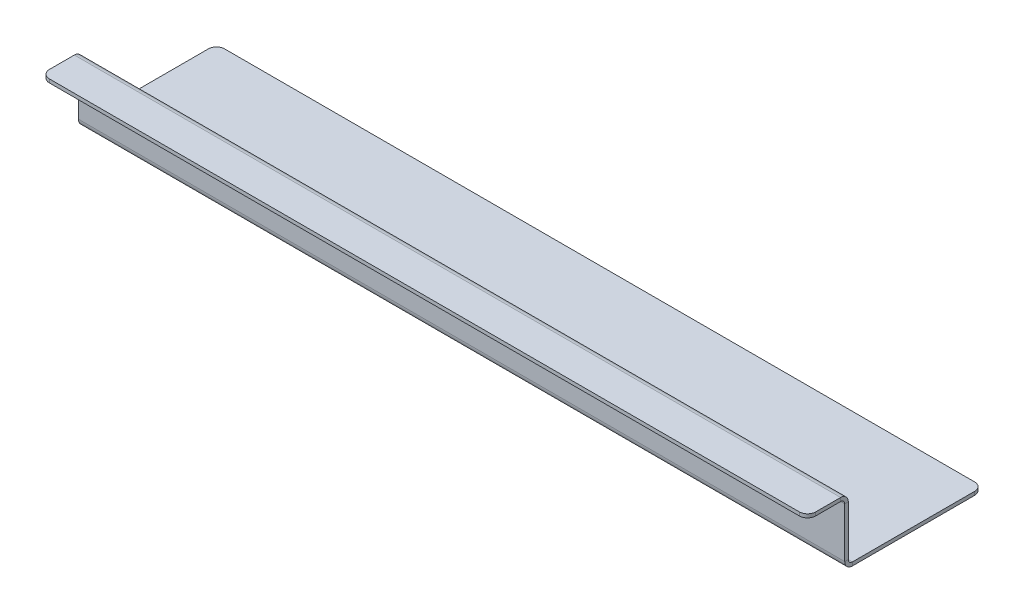
from build123d import *

# Parameters (mm, degrees)
SKETCH1_W                    = 596.9
SKETCH1_H                    = 31.75
BASE_FLANGE1_DEPTH           = 2.75336
EDGE_FLANGE1_STRIP_W         = 17.36344
EDGE_FLANGE1_STRIP_H         = 2.75336
EDGE_FLANGE1_STRIP_CUT_DEPTH = 596.9
EDGE_FLANGE1_DEPTH           = 596.9
EDGE_FLANGE2_STRIP_W         = 17.36344
EDGE_FLANGE2_STRIP_H         = 2.75336
EDGE_FLANGE2_STRIP_CUT_DEPTH = 596.9
EDGE_FLANGE2_DEPTH           = 596.9
BREAK_CORNER1_START          = -50.8
BREAK_CORNER1_DEPTH          = 50.8


# Read off the part's stored shape, not the designer's step: Break-Corner1
# Sheet-metal steps are written as plain solids
with BuildPart() as part:
    # Sketch1 → Base-Flange1 (new body)
    with BuildSketch(Plane(origin=(0, 0, 0), x_dir=(1, 0, 0), z_dir=(0, 1, 0))):
        with Locations((298.45, 15.875)):
            Rectangle(SKETCH1_W, SKETCH1_H)
    extrude(amount=-BASE_FLANGE1_DEPTH)

    # Edge-Flange1 strip (across the edge) → Edge-Flange1 strip cut (cut)
    with BuildSketch(Plane(origin=(0, -2.75336, -31.75), x_dir=(0, 0, 1), z_dir=(1, 0, 0))):
        with Locations((-2.75336, -1.37668)):
            Rectangle(EDGE_FLANGE1_STRIP_W, EDGE_FLANGE1_STRIP_H)
    extrude(amount=EDGE_FLANGE1_STRIP_CUT_DEPTH, mode=Mode.SUBTRACT)

    # Edge-Flange1 section (across the edge) → Edge-Flange1 (add)
    with BuildSketch(Plane(origin=(0, -2.75336, -31.75), x_dir=(0, 0, 1), z_dir=(1, 0, 0))):
        with BuildLine():
            Line((0, 3.175), (0, 48.04664))
            Line((0, 48.04664), (2.75336, 48.04664))
            Line((2.75336, 48.04664), (2.75336, 3.175))
            ThreePointArc((2.75336, 3.175), (3.68329597, 0.92993597), (5.92836, 0))
            Line((5.92836, 0), (5.92836, -2.75336))
            ThreePointArc((5.92836, -2.75336), (1.736376443, -1.016983557), (0, 3.175))
        make_face()
    extrude(amount=EDGE_FLANGE1_DEPTH)

    # Edge-Flange2 strip (across the edge) → Edge-Flange2 strip cut (cut)
    with BuildSketch(Plane(origin=(596.9, -50.8, -31.75), x_dir=(0, 1, 0), z_dir=(-1, 0, 0))):
        with Locations((-2.75336, -1.37668)):
            Rectangle(EDGE_FLANGE2_STRIP_W, EDGE_FLANGE2_STRIP_H)
    extrude(amount=EDGE_FLANGE2_STRIP_CUT_DEPTH, mode=Mode.SUBTRACT)

    # Edge-Flange2 section (across the edge) → Edge-Flange2 (add)
    with BuildSketch(Plane(origin=(596.9, -50.8, -31.75), x_dir=(0, 1, 0), z_dir=(-1, 0, 0))):
        with BuildLine():
            Line((0, 3.175), (0, 104.775))
            Line((0, 104.775), (2.75336, 104.775))
            Line((2.75336, 104.775), (2.75336, 3.175))
            ThreePointArc((2.75336, 3.175), (3.68329597, 0.92993597), (5.92836, 0))
            Line((5.92836, 0), (5.92836, -2.75336))
            ThreePointArc((5.92836, -2.75336), (1.736376443, -1.016983557), (0, 3.175))
        make_face()
    extrude(amount=EDGE_FLANGE2_DEPTH)

    # Break-Corner1 outline → Break-Corner1 (cut)
    with BuildSketch(Plane(origin=(0, 0, 0), x_dir=(1, 0, 0), z_dir=(0, 1, 0)).offset(BREAK_CORNER1_START)):
        with BuildLine():
            Line((0, 0), (6.35, 0))
            ThreePointArc((6.35, 0), (1.859871939, 1.859871939), (0, 6.35))
            Line((0, 6.35), (0, 0))
        make_face()
        with BuildLine():
            ThreePointArc((596.9, 6.35), (595.040128061, 1.859871939), (590.55, 0))
            Line((590.55, 0), (596.9, 0))
            Line((596.9, 0), (596.9, 6.35))
        make_face()
        with BuildLine():
            ThreePointArc((0, 130.175), (1.859871939, 134.665128061), (6.35, 136.525))
            Line((6.35, 136.525), (0, 136.525))
            Line((0, 136.525), (0, 130.175))
        make_face()
        with BuildLine():
            ThreePointArc((590.55, 136.525), (595.040128061, 134.665128061), (596.9, 130.175))
            Line((596.9, 130.175), (596.9, 136.525))
            Line((596.9, 136.525), (590.55, 136.525))
        make_face()
    extrude(amount=BREAK_CORNER1_DEPTH, mode=Mode.SUBTRACT)


solid = part.part
